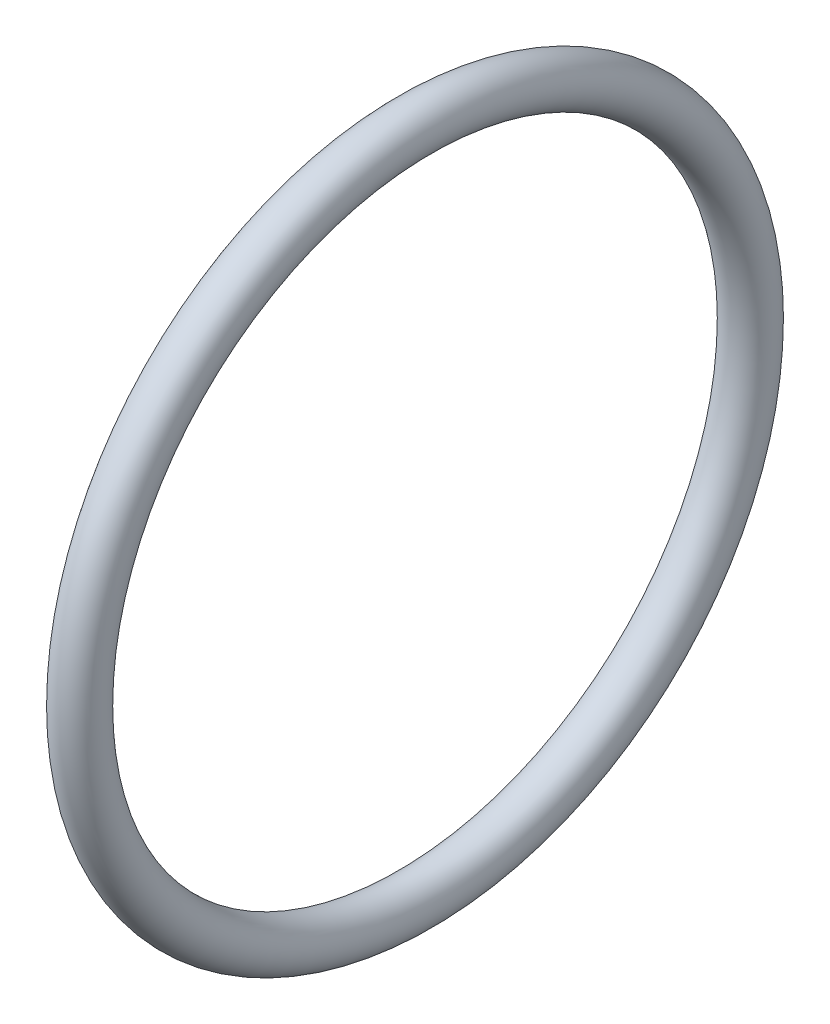
from build123d import *

# Parameters (mm, degrees)
SKETCH3_R = 0.449999989


with BuildPart() as part:
    # Sketch3 → Revolve1 (revolve)
    with BuildSketch(Plane.XY):
        with Locations((10.419999861, 6.449999927)):
            Circle(SKETCH3_R)
    revolve(axis=Axis((0, 0, 0), (1, 0, 0)))


solid = part.part
